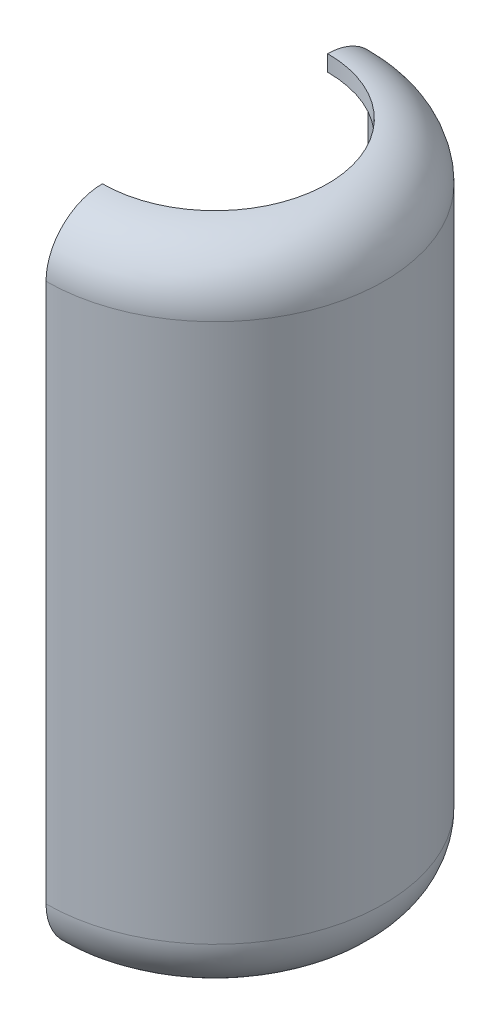
from build123d import *

# Parameters (mm, degrees)
SKETCH1_R           = 10.5
BOSS_EXTRUDE1_DEPTH = 40.5
FILLET1_R           = 3.5
SKETCH2_W           = 41.275373403
SKETCH2_H           = 50.56233242
CUT_EXTRUDE1_DEPTH  = 40.5


# Read off the part's stored shape, not the designer's step: Shell4
with BuildPart() as part:
    # Sketch1 → Boss-Extrude1 (new body)
    with BuildSketch(Plane(origin=(0, 0, 0), x_dir=(1, 0, 0), z_dir=(0, 1, 0))):
        with Locations(Location((0, 0, 0), (0, 0, 270))):
            Circle(SKETCH1_R)
    extrude(amount=BOSS_EXTRUDE1_DEPTH)

    # Fillet1
    fillet1_edges = [part.edges().sort_by_distance(p)[0] for p in [
        (0, 0, -10.5),
        (0, 40.5, -10.5),
    ]]
    fillet(fillet1_edges, radius=FILLET1_R)

    # Sketch2 → Cut-Extrude1 (cut)
    with BuildSketch(Plane(origin=(0, 0, 0), x_dir=(0, 0, -1), z_dir=(1, 0, 0))):
        with Locations((2.800828909, 23.566771077)):
            Rectangle(SKETCH2_W, SKETCH2_H)
    extrude(amount=-CUT_EXTRUDE1_DEPTH, mode=Mode.SUBTRACT)

    # Shell4 outline → Shell4 (revolve, cut)
    with BuildSketch(Plane.XY):
        with BuildLine():
            Line((0, 1), (7, 1))
            ThreePointArc((7, 1), (8.767766953, 1.732233047), (9.5, 3.5))
            Line((9.5, 3.5), (9.5, 37))
            ThreePointArc((9.5, 37), (8.767766953, 38.767766953), (7, 39.5))
            Line((7, 39.5), (7, 40.5))
            Line((7, 40.5), (0, 40.5))
            Line((0, 40.5), (0, 1))
        make_face()
    revolve(axis=Axis((0, 0, 0), (0, 1, 0)), mode=Mode.SUBTRACT)


solid = part.part
